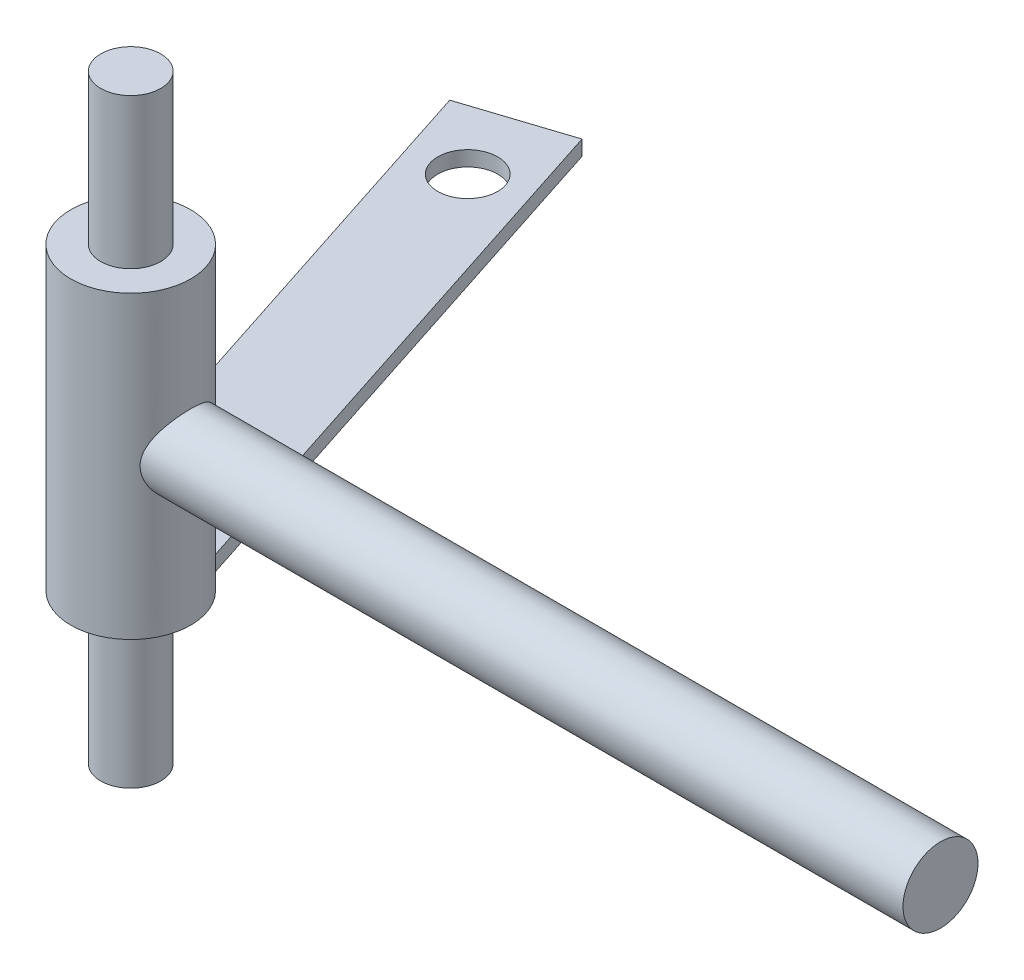
from build123d import *

# Parameters (mm, degrees)
SKETCH1_R           = 4
BOSS_EXTRUDE1_DEPTH = 40
SKETCH3_R           = 8
BOSS_EXTRUDE2_DEPTH = 20
SKETCH4_R           = 5
BOSS_EXTRUDE3_DEPTH = 108
SKETCH5_W           = 14
SKETCH5_H           = 2
BOSS_EXTRUDE4_DEPTH = 80
CUT_EXTRUDE1_REACH  = 146.647
SKETCH6_R           = 4


with BuildPart() as part:
    # Sketch1 → Boss-Extrude1 (new, symmetric)
    with BuildSketch(Plane(origin=(0, 0, 0), x_dir=(1, 0, 0), z_dir=(0, 1, 0))):
        Circle(SKETCH1_R)
    extrude(amount=BOSS_EXTRUDE1_DEPTH, both=True)

    # Sketch3 → Boss-Extrude2 (add, symmetric)
    with BuildSketch(Plane(origin=(0, 0, 0), x_dir=(1, 0, 0), z_dir=(0, 1, 0))):
        Circle(SKETCH3_R)
    extrude(amount=BOSS_EXTRUDE2_DEPTH, both=True)

    # Sketch4 → Boss-Extrude3 (add)
    with BuildSketch(Plane(origin=(0, 0, 0), x_dir=(0, 0, -1), z_dir=(1, 0, 0))):
        Circle(SKETCH4_R)
    extrude(amount=BOSS_EXTRUDE3_DEPTH)

    # Sketch5 → Boss-Extrude4 (add)
    with BuildSketch(Plane(origin=(0, 0, 0), x_dir=(0.9510565162951534, 0, -0.3090169943749482), z_dir=(0.3090169943749482, 0, 0.9510565162951534))):
        with Locations((0, -17)):
            Rectangle(SKETCH5_W, SKETCH5_H)
    extrude(amount=-BOSS_EXTRUDE4_DEPTH)

    # Sketch6 → Cut-Extrude1 (cut, up to next)
    with BuildSketch(Plane(origin=(0, -16, 0), x_dir=(1, 0, 0), z_dir=(0, 1, 0)), mode=Mode.PRIVATE) as cut_extrude1_sk1:
        with Locations((-21.631189606, 66.573956141)):
            Circle(SKETCH6_R)
    cut_extrude1_tool1 = extrude(cut_extrude1_sk1.sketch, amount=-CUT_EXTRUDE1_REACH, mode=Mode.PRIVATE) & part.part
    add(cut_extrude1_tool1.solids().sort_by_distance((-21.63119, -16, -66.573956))[0], mode=Mode.SUBTRACT)


solid = part.part
